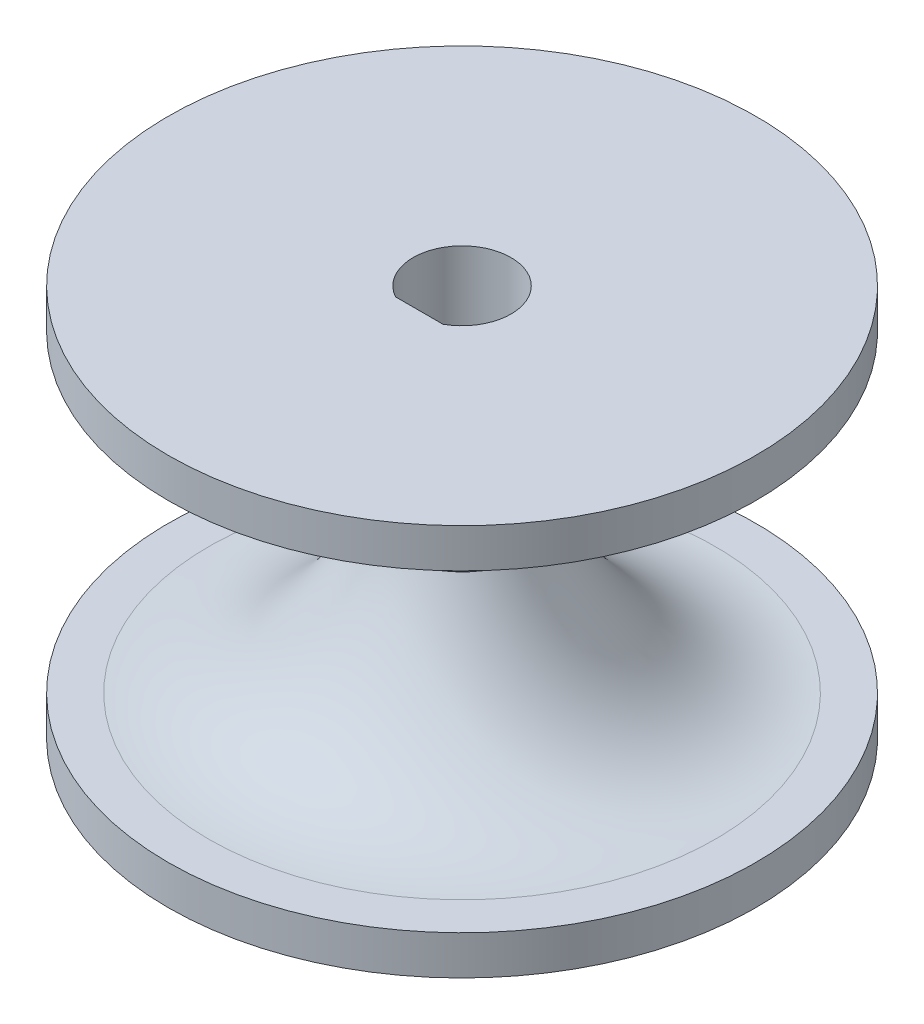
from build123d import *

# Parameters (mm, degrees)
SKETCH1_R           = 24
BOSS_EXTRUDE1_DEPTH = 3.2
SKETCH2_R           = 6
BOSS_EXTRUDE2_DEPTH = 25.6
SKETCH3_R           = 24
BOSS_EXTRUDE3_DEPTH = 3.2
CUT_EXTRUDE1_DEPTH  = 10


with BuildPart() as part:
    # Sketch1 → Boss-Extrude1 (new body)
    with BuildSketch(Plane(origin=(0, 0, 0), x_dir=(1, 0, 0), z_dir=(0, 1, 0))):
        Circle(SKETCH1_R)
    extrude(amount=BOSS_EXTRUDE1_DEPTH)

    # Sketch2 → Boss-Extrude2 (add)
    with BuildSketch(Plane(origin=(0, 3.2, 0), x_dir=(1, 0, 0), z_dir=(0, 1, 0))):
        Circle(SKETCH2_R)
    extrude(amount=BOSS_EXTRUDE2_DEPTH)

    # Sketch3 → Boss-Extrude3 (add)
    with BuildSketch(Plane(origin=(0, 28.8, 0), x_dir=(1, 0, 0), z_dir=(0, 1, 0))):
        Circle(SKETCH3_R)
    extrude(amount=BOSS_EXTRUDE3_DEPTH)

    # Sketch4 → Cut-Extrude1 (cut)
    with BuildSketch(Plane(origin=(0, 32, 0), x_dir=(1, 0, 0), z_dir=(0, 1, 0))):
        with BuildLine():
            Line((-1.936491673, -3.5), (1.936491673, -3.5))
            ThreePointArc((1.936491673, -3.5), (0, 4), (-1.936491673, -3.5))
        make_face()
    extrude(amount=-CUT_EXTRUDE1_DEPTH, mode=Mode.SUBTRACT)

    # Sketch5 → Revolve1 (revolve)
    with BuildSketch(Plane(origin=(0, 0, 0), x_dir=(-1, 0, 0), z_dir=(0, 0, -1))):
        with BuildLine():
            add(Edge.make_bspline(
                [(-6, 16), (-10.991136695, 3.298924518), (-20.7, 3.2)],
                knots=[0, 0, 0, 0.984543044, 0.984543044, 0.984543044], degree=2))
            Line((-20.7, 3.2), (-6, 3.2))
            Line((-6, 3.2), (-6, 16))
        make_face()
    revolve1 = revolve(axis=Axis((0, 28.8, 0), (0, -1, 0)))

    # Mirror1: Revolve1 across plane
    add(revolve1.mirror(Plane(origin=(0, 16, 0), x_dir=(0, 0, 1), z_dir=(0, -1, 0))))


solid = part.part
